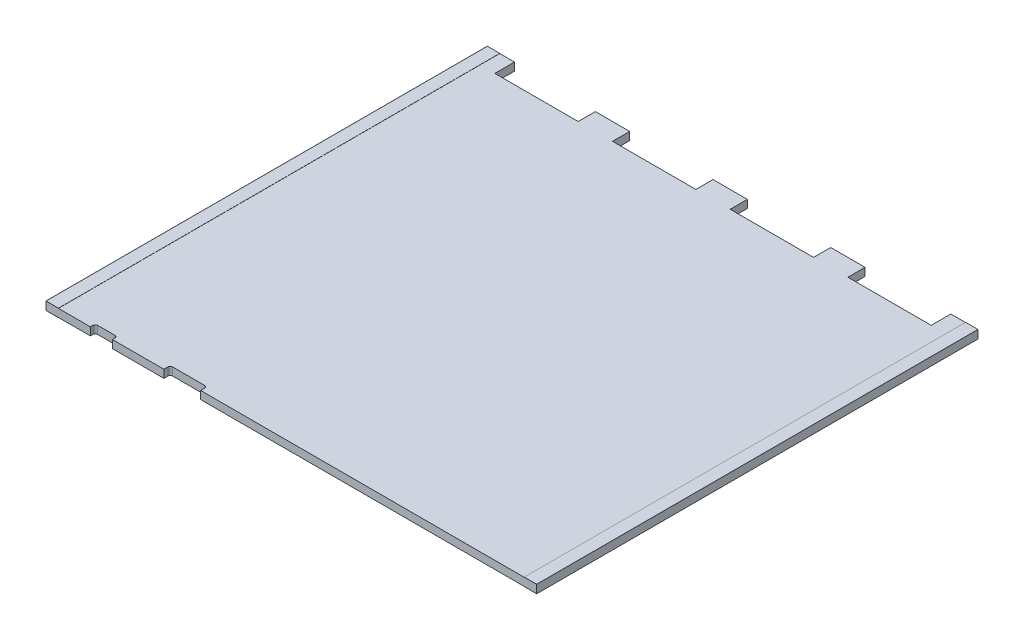
from build123d import *

# Parameters (mm, degrees)
FR4_DEPTH              = 1.61544
SKETCH2_W              = 2.5
SKETCH2_H              = 90
TOP_PLATING_DEPTH      = 0.03556
TOP_PLATING_2_DEPTH    = 0.03556
SKETCH3_W              = 2.5
SKETCH3_H              = 90
BOTTOM_PLATING_DEPTH   = 0.03556
BOTTOM_PLATING_2_DEPTH = 0.03556
SKETCH4_W              = 90
SKETCH4_H              = 1.68656
LEFT_PLATING_DEPTH     = 0.03556
SKETCH5_W              = 90
SKETCH5_H              = 1.68656
RIGHT_PLATING_DEPTH    = 0.03556


with BuildPart() as part:
    # Sketch1 → FR4 (new body)
    with BuildSketch(Plane(origin=(0, 0, 0), x_dir=(1, 0, 0), z_dir=(0, 1, 0))):
        with BuildLine():
            Line((9, 0), (9, 0.5))
            ThreePointArc((9, 0.5), (9.146446609, 0.853553391), (9.5, 1))
            Line((9.5, 1), (13, 1))
            ThreePointArc((13, 1), (13.353553391, 0.853553391), (13.5, 0.5))
            Line((13.5, 0.5), (13.5, 0))
            Line((13.5, 0), (24, 0))
            Line((24, 0), (24, 0.8))
            ThreePointArc((24, 0.8), (24.146446609, 1.153553391), (24.5, 1.3))
            Line((24.5, 1.3), (31, 1.3))
            ThreePointArc((31, 1.3), (31.353553391, 1.153553391), (31.5, 0.8))
            Line((31.5, 0.8), (31.5, 0))
            Line((31.5, 0), (100, 0))
            Line((100, 0), (100, 90))
            Line((100, 90), (94.50001532, 90))
            Line((94.50001532, 90), (94.50001532, 86))
            Line((94.50001532, 86), (77.50000766, 86))
            Line((77.50000766, 86), (77.50000766, 89.5))
            Line((77.50000766, 89.5), (70.50000766, 89.5))
            Line((70.50000766, 89.5), (70.50000766, 86))
            Line((70.50000766, 86), (53.5, 86))
            Line((53.5, 86), (53.5, 89.5))
            Line((53.5, 89.5), (46.5, 89.5))
            Line((46.5, 89.5), (46.5, 86))
            Line((46.5, 86), (29.49999234, 86))
            Line((29.49999234, 86), (29.49999234, 89.5))
            Line((29.49999234, 89.5), (22.49999234, 89.5))
            Line((22.49999234, 89.5), (22.49999234, 86))
            Line((22.49999234, 86), (5.49998468, 86))
            Line((5.49998468, 86), (5.49998468, 90))
            Line((5.49998468, 90), (0, 90))
            Line((0, 90), (0, 0))
            Line((0, 0), (9, 0))
        make_face()
    extrude(amount=FR4_DEPTH)


with BuildPart() as body_2:
    # Sketch2 → top-plating (new body)
    with BuildSketch(Plane(origin=(0, 1.61544, 0), x_dir=(1, 0, 0), z_dir=(0, 1, 0))):
        with Locations((1.25, 45)):
            Rectangle(SKETCH2_W, SKETCH2_H)
    extrude(amount=TOP_PLATING_DEPTH)


with BuildPart() as body_3:
    # Sketch2 → top-plating 2 (new body)
    with BuildSketch(Plane(origin=(0, 1.61544, 0), x_dir=(1, 0, 0), z_dir=(0, 1, 0))):
        with Locations((98.75, 45)):
            Rectangle(SKETCH2_W, SKETCH2_H)
    extrude(amount=TOP_PLATING_2_DEPTH)


with BuildPart() as body_4:
    # Sketch3 → bottom-plating (new body)
    with BuildSketch(Plane.XZ):
        with Locations((1.25, -45)):
            Rectangle(SKETCH3_W, SKETCH3_H)
    extrude(amount=BOTTOM_PLATING_DEPTH)


with BuildPart() as body_5:
    # Sketch3 → bottom-plating 2 (new body)
    with BuildSketch(Plane.XZ):
        with Locations((98.75, -45)):
            Rectangle(SKETCH3_W, SKETCH3_H)
    extrude(amount=BOTTOM_PLATING_2_DEPTH)


with BuildPart() as body_6:
    # Sketch4 → left-plating (new body)
    with BuildSketch(Plane.ZY):
        with Locations((-45, 0.80772)):
            Rectangle(SKETCH4_W, SKETCH4_H)
    extrude(amount=LEFT_PLATING_DEPTH)


with BuildPart() as body_7:
    # Sketch5 → right-plating (new body)
    with BuildSketch(Plane(origin=(100, 0, 0), x_dir=(0, 0, -1), z_dir=(1, 0, 0))):
        with Locations((45, 0.80772)):
            Rectangle(SKETCH5_W, SKETCH5_H)
    extrude(amount=RIGHT_PLATING_DEPTH)


solid = Compound([part.part, body_2.part, body_3.part, body_4.part, body_5.part, body_6.part, body_7.part])
